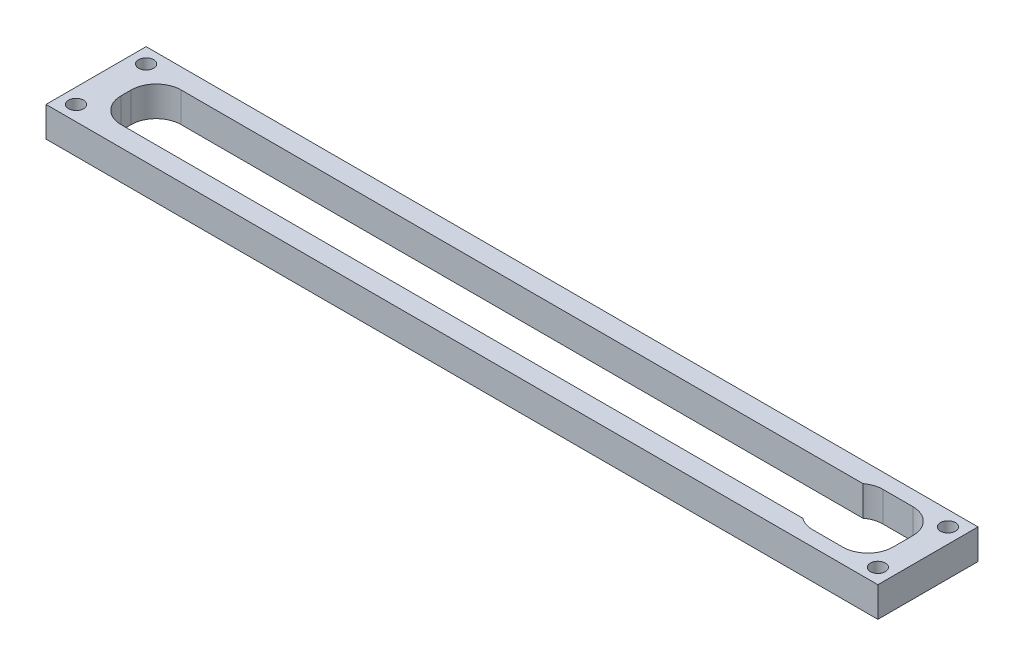
from build123d import *

# Parameters (mm, degrees)
SKETCH1_W           = 166.159725664
SKETCH1_H           = 20
SKETCH1_R           = 1.5
SKETCH1_W_2         = 154.159725664
SKETCH1_H_2         = 12
BOSS_EXTRUDE1_DEPTH = 6
CUT_EXTRUDE1_DEPTH  = 168.466577062
FILLET1_R           = 5


with BuildPart() as part:
    # Sketch1 → Boss-Extrude1 (new body)
    with BuildSketch(Plane(origin=(0, 0, 0), x_dir=(1, 0, 0), z_dir=(0, 1, 0))):
        with Locations((83.079862832, 10)):
            Rectangle(SKETCH1_W, SKETCH1_H)
        with Locations(Location((3, 17, 0), (0, 0, 270))):
            Circle(SKETCH1_R, mode=Mode.SUBTRACT)
        with Locations(Location((3, 3, 0), (0, 0, 90))):
            Circle(SKETCH1_R, mode=Mode.SUBTRACT)
        with Locations(Location((163.159725664, 3, 0), (0, 0, 270))):
            Circle(SKETCH1_R, mode=Mode.SUBTRACT)
        with Locations(Location((163.159725664, 17, 0), (0, 0, 90))):
            Circle(SKETCH1_R, mode=Mode.SUBTRACT)
        with Locations((83.079862832, 10)):
            Rectangle(SKETCH1_W_2, SKETCH1_H_2, mode=Mode.SUBTRACT)
    extrude(amount=BOSS_EXTRUDE1_DEPTH)

    # Sketch2 → Cut-Extrude1 (cut, through all)
    with BuildSketch(Plane(origin=(0, 6, 0), x_dir=(1, 0, 0), z_dir=(0, 1, 0))):
        Polygon((147.159725664, 17), (147.159725664, 16), (160.159725664, 16), (160.159725664, 4), (147.159725664, 4), (147.159725664, 3), (161.159725664, 3), (161.159725664, 17), align=None)
    extrude(amount=-CUT_EXTRUDE1_DEPTH, mode=Mode.SUBTRACT)

    # Fillet1
    # the kernel refuses this fillet: 5 mm, written as the material it adds along each edge
    with BuildSketch(Plane(origin=(161.159725664, 6, -17), x_dir=(0, 0, 1), z_dir=(0, -1, 0)), Plane(origin=(161.159725664, 6, -3), x_dir=(-1, 0, 0), z_dir=(0, -1, 0)), Plane(origin=(6, 0, -16), x_dir=(0, 0, 1), z_dir=(0, 1, 0))) as fillet1_piece_1:
        with BuildLine():
            CenterArc((FILLET1_R, FILLET1_R), FILLET1_R, 180, 90)
            Line((0, FILLET1_R), (-FILLET1_R * 0.02, FILLET1_R))
            Line((-FILLET1_R * 0.02, FILLET1_R), (-FILLET1_R * 0.02, -FILLET1_R * 0.02))
            Line((-FILLET1_R * 0.02, -FILLET1_R * 0.02), (FILLET1_R, -FILLET1_R * 0.02))
            Line((FILLET1_R, -FILLET1_R * 0.02), (FILLET1_R, 0))
        make_face()
    extrude(amount=6)
    with BuildSketch(Plane(origin=(147.159725664, 6, -17), x_dir=(1, 0, 0), z_dir=(0, -1, 0))) as fillet1_piece_2:
        with BuildLine():
            CenterArc((3, 5), FILLET1_R, 233.130102354, 36.869897646)
            Line((0, 1), (-0.06, 0.92))
            ThreePointArc((-0.06, 0.92), (-0.1, 0.5), (-0.1, 0))
            Line((-0.1, 0), (0, -0.1))
            Line((0, -0.1), (3, -0.1))
            Line((3, -0.1), (3, 0))
        make_face()
    extrude(amount=6)
    with BuildSketch(Plane(origin=(147.159725664, 6, -3), x_dir=(0, 0, -1), z_dir=(0, -1, 0))) as fillet1_piece_3:
        with BuildLine():
            CenterArc((5, 3), FILLET1_R, 180, 36.869897646)
            Line((0, 3), (-0.1, 3))
            Line((-0.1, 3), (-0.1, 0))
            Line((-0.1, 0), (0, -0.1))
            ThreePointArc((0, -0.1), (0.5, -0.1), (0.92, -0.06))
            Line((0.92, -0.06), (1, 0))
        make_face()
    extrude(amount=6)
    with BuildSketch(Plane(origin=(6, 0, -4), x_dir=(0, 0, -1), z_dir=(0, 1, 0))) as fillet1_piece_4:
        with BuildLine():
            CenterArc((FILLET1_R, -FILLET1_R), FILLET1_R, 90, 90)
            Line((0, -FILLET1_R), (-FILLET1_R * 0.02, -FILLET1_R))
            Line((-FILLET1_R * 0.02, -FILLET1_R), (-FILLET1_R * 0.02, FILLET1_R * 0.02))
            Line((-FILLET1_R * 0.02, FILLET1_R * 0.02), (FILLET1_R, FILLET1_R * 0.02))
            Line((FILLET1_R, FILLET1_R * 0.02), (FILLET1_R, 0))
        make_face()
    extrude(amount=6)


solid = part.part
